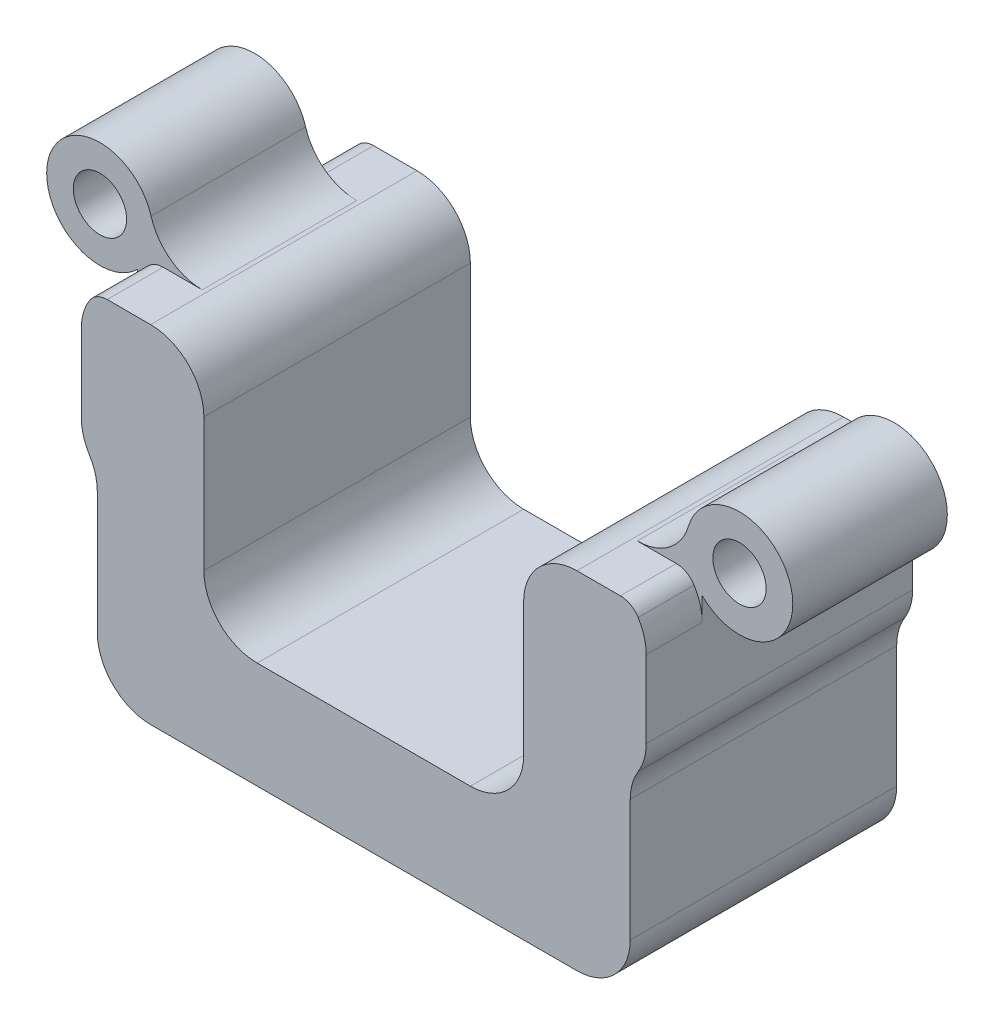
from build123d import *

# Parameters (mm, degrees)
BOSS_EXTRUDE1_DEPTH = 12.7
SKETCH3_R           = 1.27
BOSS_EXTRUDE2_DEPTH = 12.7
CUT_EXTRUDE6_START  = 13.462
CUT_EXTRUDE6_DEPTH  = 13.462
FILLET2_R           = 2.54
FILLET3_R           = 2.54
FILLET4_R           = 2.54
FILLET5_R           = 2.54
FILLET6_R           = 1


with BuildPart() as part:
    # Sketch1 → Boss-Extrude1 (new body)
    with BuildSketch(Plane.XY):
        Polygon((-5.08, -5.08), (-5.08, 11.43), (0, 11.43), (0, 0), (15.24, 0), (15.24, 11.43), (20.32, 11.43), (20.32, -5.08), align=None)
    extrude(amount=BOSS_EXTRUDE1_DEPTH)

    # Sketch3 → Boss-Extrude2 (add)
    with BuildSketch(Plane.XY.offset(12.7)):
        with BuildLine():
            Line((-5.08, 5.08), (-5.08, 12.532978233))
            ThreePointArc((-5.08, 12.532978233), (-9.961764292, 13.516716003), (-5.842, 10.719055412))
            Line((-5.842, 10.719055412), (-5.842, 5.08))
            Line((-5.842, 5.08), (-5.08, 5.08))
        make_face()
        with Locations((-7.62, 12.532978233)):
            Circle(SKETCH3_R, mode=Mode.SUBTRACT)
    boss_extrude2 = extrude(amount=-BOSS_EXTRUDE2_DEPTH)

    # Sketch9 → Cut-Extrude6 (cut)
    with BuildSketch(Plane.XY.offset(10.033).offset(CUT_EXTRUDE6_START)):
        with BuildLine():
            Line((-5.08, 12.532978233), (-5.08, 11.43))
            Line((-5.08, 11.43), (-5.842, 10.719055412))
            ThreePointArc((-5.842, 10.719055412), (-9.961764292, 13.516716003), (-5.08, 12.532978233))
        make_face()
        with BuildLine():
            Line((21.082, 10.719055412), (20.32, 11.43))
            Line((20.32, 11.43), (20.32, 12.532978233))
            ThreePointArc((20.32, 12.532978233), (25.201764292, 13.516716003), (21.082, 10.719055412))
        make_face()
    cut_extrude6 = extrude(amount=-CUT_EXTRUDE6_DEPTH, mode=Mode.SUBTRACT)

    # Fillet2
    fillet2_edges = [part.edges().sort_by_distance(p)[0] for p in [
        (15.24, 11.43, 6.35),
        (0, 11.43, 6.35),
    ]]
    fillet(fillet2_edges, radius=FILLET2_R)

    # Fillet3
    fillet3_edges = [part.edges().sort_by_distance(p)[0] for p in [
        (0, 0, 6.35),
        (15.24, 0, 6.35),
    ]]
    fillet(fillet3_edges, radius=FILLET3_R)

    # Mirror1: Boss-Extrude2, Cut-Extrude6 across plane
    add(boss_extrude2.mirror(Plane(origin=(7.62, 0, 0), x_dir=(0, 0, 1), z_dir=(1, 0, 0))))
    add(cut_extrude6.mirror(Plane(origin=(7.62, 0, 0), x_dir=(0, 0, 1), z_dir=(1, 0, 0))), mode=Mode.SUBTRACT)

    # Mirror3: Cut-Extrude6 across plane
    add(cut_extrude6.mirror(Plane.XY.offset(6.35)), mode=Mode.SUBTRACT)

    # Fillet4
    # the kernel refuses this fillet: 2.54 mm, written as the material it adds along each edge
    with BuildSketch(Plane(origin=(20.32, 11.43, 10.033), x_dir=(-1, 0, 0), z_dir=(0, 0, -1)), Plane(origin=(-5.08, 11.43, 2.667), x_dir=(1, 0, 0), z_dir=(0, 0, 1))) as fillet4_piece_1:
        with BuildLine():
            CenterArc((2.332511513, 2.54), FILLET4_R, 196.432066058, 73.567933942)
            Line((-0.103744244, 1.821489116), (-0.347369819, 1.749638028))
            ThreePointArc((-0.347369819, 1.749638028), (-0.254, 1.102978233), (-0.254, 0))
            Line((-0.254, 0), (0, -0.254))
            Line((0, -0.254), (2.332511513, -0.254))
            Line((2.332511513, -0.254), (2.332511513, 0))
        make_face()
    extrude(amount=7.366)
    with BuildSketch(Plane(origin=(20.32, 5.08, 12.7), x_dir=(0, -1, 0), z_dir=(0, 0, -1))) as fillet4_piece_2:
        with BuildLine():
            CenterArc((1.813922821, -2.54), FILLET4_R, 90, 45.572995999)
            Line((0, -0.762), (0, 0))
            Line((0, 0), (1.813922821, 0))
        make_face()
    extrude(amount=12.7)
    with BuildSketch(Plane(origin=(-5.08, 5.08, 12.7), x_dir=(-1, 0, 0), z_dir=(0, 0, -1))) as fillet4_piece_3:
        with BuildLine():
            CenterArc((2.54, -1.813922821), FILLET4_R, 134.427004001, 45.572995999)
            Line((0, -1.813922821), (0, 0))
            Line((0, 0), (0.762, 0))
        make_face()
    extrude(amount=12.7)
    # the kernel refuses this fillet: 2.54 mm, written as the material it takes off along each edge
    with BuildSketch(Plane(origin=(-5.842, 10.719055412, 15.457445582), x_dir=(0.7311775057890088, 0.6821872580370908, 0), z_dir=(0, 0, -1)), Plane(origin=(-5.842, 10.719055412, 2.667), x_dir=(0.7311775057890088, 0.6821872580370908, 0), z_dir=(0, 0, -1))) as fillet4_2_piece_1:
        with BuildLine():
            CenterArc((1.104753168, 2.539228509), FILLET4_R, 223.014800445, 45.572995999)
            Line((-0.752437696, 0.806472873), (0, 0))
            Line((0, 0), (1.042154599, 0))
        make_face()
    extrude(amount=5.424445582, mode=Mode.SUBTRACT)
    with BuildSketch(Plane(origin=(21.082, 10.719055412, 2.667), x_dir=(-0.7311775057890088, 0.6821872580370906, 0), z_dir=(0, 0, -1))) as fillet4_2_piece_2:
        with BuildLine():
            CenterArc((1.104753168, -2.539228509), FILLET4_R, 91.412203555, 45.572995999)
            Line((-0.752437696, -0.806472873), (0, 0))
            Line((0, 0), (1.042154599, 0))
        make_face()
    extrude(amount=5.424445582, mode=Mode.SUBTRACT)
    with BuildSketch(Plane(origin=(21.082, 10.719055412, 15.457445582), x_dir=(0, -1, 0), z_dir=(0, 0, -1))) as fillet4_2_piece_3:
        with BuildLine():
            CenterArc((1.102978233, 2.54), FILLET4_R, 224.427004001, 45.572995999)
            Line((-0.710944588, 0.762), (0, 0))
            Line((0, 0), (1.102978233, 0))
        make_face()
    extrude(amount=5.424445582, mode=Mode.SUBTRACT)

    # Fillet5
    fillet5_edges = [part.edges().sort_by_distance(p)[0] for p in [
        (20.32, -5.08, 6.35),
        (-5.08, -5.08, 6.35),
        (-5.842, 5.08, 6.35),
        (21.082, 5.08, 6.35),
    ]]
    fillet(fillet5_edges, radius=FILLET5_R)

    # Fillet6
    fillet6_edges = [part.edges().sort_by_distance(p)[0] for p in [
        (-5.08, 11.43, 1.3335),
        (20.32, 11.43, 11.3665),
        (20.32, 11.43, 1.3335),
        (-5.08, 11.43, 11.3665),
    ]]
    fillet(fillet6_edges, radius=FILLET6_R)


solid = part.part
